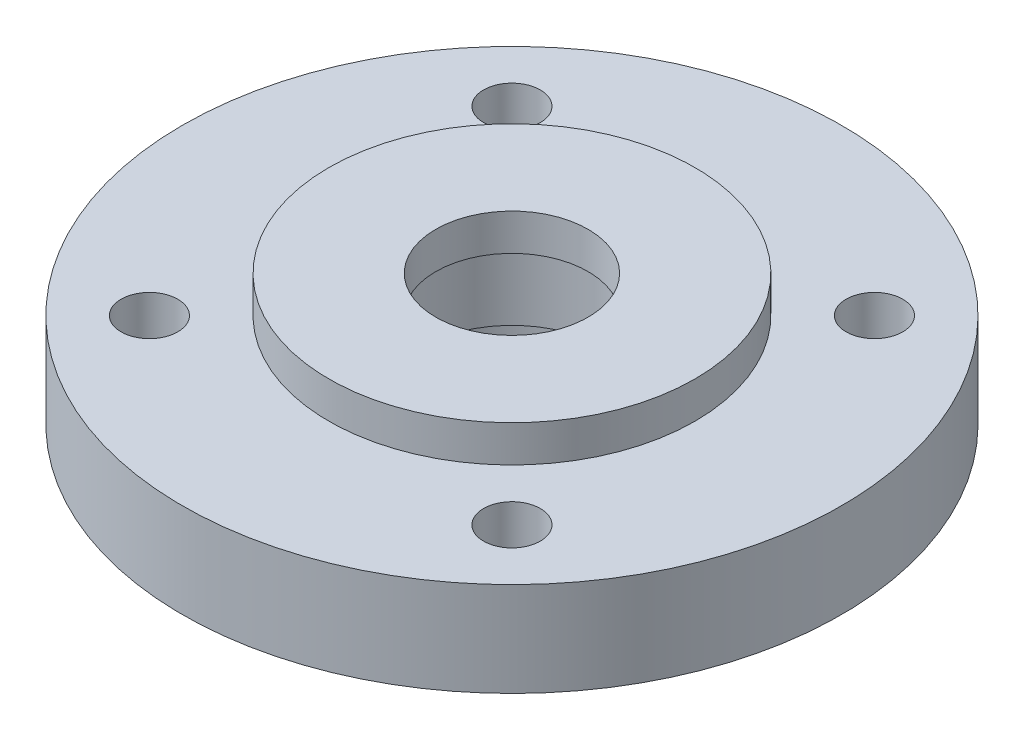
from build123d import *

# Parameters (mm, degrees)
F_10_0_1935_DIAMETER_HOLE1_D = 4.9149


with BuildPart() as part:
    # Sketch1 → Revolve1 (revolve)
    with BuildSketch(Plane.XY):
        Polygon((-15.875, -62.480212574), (-6.604, -62.480212574), (-6.604, -65.655212574), (-7.9375, -65.655212574), (-7.9375, -72.005212574), (-9.5, -72.005212574), (-9.5, -77.005212574), (-14.2875, -77.005212574), (-14.2875, -73.830212574), (-14.2875, -70.693312574), (-19.05, -70.693312574), (-19.05, -73.830212574), (-28.575, -73.830212574), (-28.575, -65.655212574), (-15.875, -65.655212574), align=None)
    revolve(axis=Axis((0, 0, 0), (0, -1, 0)))

    # #10 (0.1935) Diameter Hole1 (through all)
    with Locations(Plane(origin=(0, -62.480212574, 0), x_dir=(1, 0, 0), z_dir=(0, 1, 0))):
        with Locations((15.715448212, 15.715448212), (-15.715448212, 15.715448212), (-15.715448212, -15.715448212), (15.715448212, -15.715448212)):
            Hole(F_10_0_1935_DIAMETER_HOLE1_D / 2)


solid = part.part
